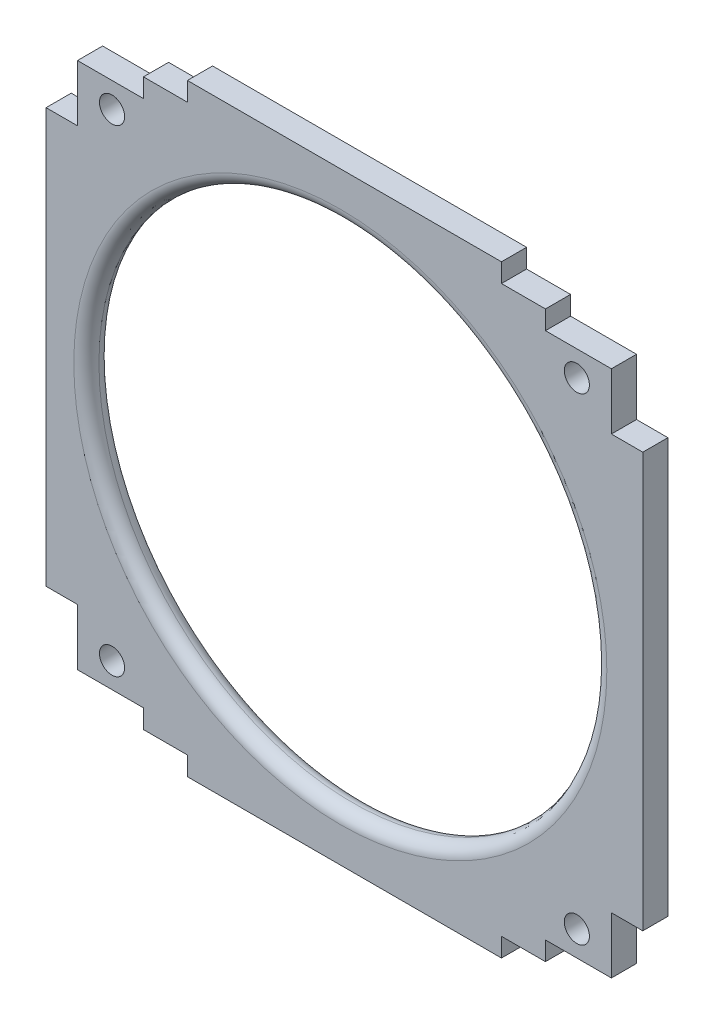
from build123d import *

# Parameters (mm, degrees)
BOSS_EXTRUDE1_DEPTH = 4
SKETCH2_R           = 2
CUT_EXTRUDE1_DEPTH  = 10
SKETCH3_R           = 30
CUT_EXTRUDE2_DEPTH  = 10
SKETCH4_R           = 40.429464175
CUT_EXTRUDE3_DEPTH  = 69.109947193
FILLET5_R           = 2
FILLET6_R           = 2


with BuildPart() as part:
    # Sketch1 → Boss-Extrude1 (new body)
    with BuildSketch(Plane.XY):
        Polygon((-46.844369636, 32.999996521), (-41.844369636, 32.999996711), (-41.844366793, 42.000003289), (-31.344369977, 41.999997109), (-31.344370091, 44.999997109), (-24.344370091, 44.999997374), (-24.344370205, 47.999997374), (25.655629795, 47.99999927), (25.655629909, 44.99999927), (32.655629909, 44.999999535), (32.655630023, 41.999999535), (43.155633207, 42.000000067), (43.155630364, 32.999999933), (48.155630364, 33.000000123), (48.155632866, -32.999999877), (43.155630364, -32.999999933), (43.155633207, -42.000000067), (32.655630023, -41.999999535), (32.655629909, -44.999999535), (25.655629909, -44.99999927), (25.655629795, -47.99999927), (-24.344370205, -47.999997374), (-24.344370091, -44.999997374), (-31.344370091, -44.999997109), (-31.344369977, -41.999997109), (-41.844366793, -42.000003289), (-41.844369636, -32.999996711), (-46.844369636, -32.999996521), align=None)
    extrude(amount=BOSS_EXTRUDE1_DEPTH)

    # Sketch2 → Cut-Extrude1 (cut)
    with BuildSketch(Plane.XY.offset(4)):
        with Locations((-36.344424402, 38.000040227)):
            Circle(SKETCH2_R)
        with Locations((37.655687631, -38.000043584)):
            Circle(SKETCH2_R)
        with Locations((37.655603638, 37.999999725)):
            Circle(SKETCH2_R)
        with Locations((-36.344340408, -38.000003081)):
            Circle(SKETCH2_R)
    extrude(amount=-CUT_EXTRUDE1_DEPTH, mode=Mode.SUBTRACT)

    # Sketch3 → Cut-Extrude2 (cut)
    with BuildSketch(Plane.XY.offset(4)):
        Circle(SKETCH3_R)
    extrude(amount=-CUT_EXTRUDE2_DEPTH, mode=Mode.SUBTRACT)

    # Sketch4 → Cut-Extrude3 (cut, through all)
    with BuildSketch(Plane.XY.offset(4)):
        Circle(SKETCH4_R)
    extrude(amount=-CUT_EXTRUDE3_DEPTH, mode=Mode.SUBTRACT)

    # Fillet5
    fillet5_edges = [part.edges().sort_by_distance(p)[0] for p in [
        (-40.429464175, 0, 4),
    ]]
    fillet(fillet5_edges, radius=FILLET5_R)

    # Fillet6
    fillet6_edges = [part.edges().sort_by_distance(p)[0] for p in [
        (-40.429464175, 0, 0),
    ]]
    fillet(fillet6_edges, radius=FILLET6_R - 0.0001)  # a hair under: the kernel refuses the full size


solid = part.part
